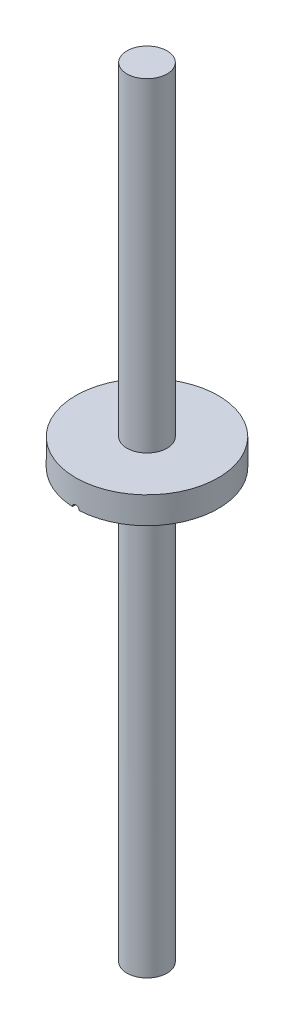
from build123d import *

# Parameters (mm, degrees)
SKETCH1_R                = 16.9291
BOSS_EXTRUDE1_DEPTH      = 6.35
CUT_EXTRUDE1_DEPTH       = 25.769161343
CUT_EXTRUDE1_DEPTH_BACK  = 25.769161343
SKETCH2_R                = 0.809435985
BOSS_EXTRUDE3_DEPTH      = 77
BOSS_EXTRUDE3_DEPTH_BACK = 108
SKETCH3_R                = 4.7625


with BuildPart() as part:
    # Sketch1 → Boss-Extrude1 (new body)
    with BuildSketch(Plane(origin=(0, 0, 0), x_dir=(1, 0, 0), z_dir=(0, 1, 0))):
        Circle(SKETCH1_R)
    extrude(amount=BOSS_EXTRUDE1_DEPTH)

    # Sketch2 → Cut-Extrude1 (cut, two sides: drawn at the far end of the back side and taken through both)
    with BuildSketch(Plane.XY.offset(-CUT_EXTRUDE1_DEPTH_BACK)):
        Circle(SKETCH2_R)
    extrude(amount=CUT_EXTRUDE1_DEPTH + CUT_EXTRUDE1_DEPTH_BACK, mode=Mode.SUBTRACT)

    # Sketch3 → Boss-Extrude3 (add, two sides: drawn at the far end of the back side and taken through both)
    with BuildSketch(Plane(origin=(0, 6.35, 0), x_dir=(1, 0, 0), z_dir=(0, 1, 0)).offset(-BOSS_EXTRUDE3_DEPTH_BACK)):
        Circle(SKETCH3_R)
    extrude(amount=BOSS_EXTRUDE3_DEPTH + BOSS_EXTRUDE3_DEPTH_BACK)


solid = part.part
